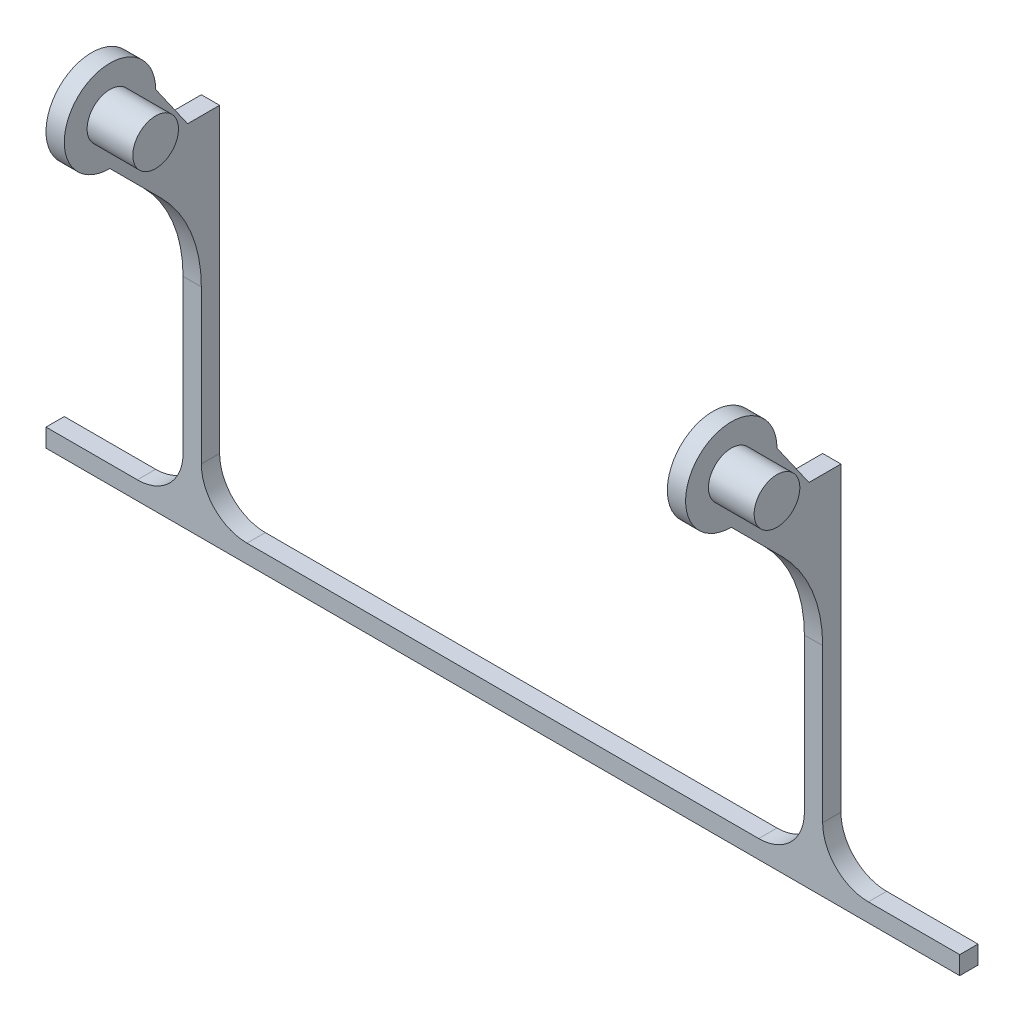
from build123d import *

# Parameters (mm, degrees)
BOSS_EXTRU_1_DEPTH = 4
BOSS_EXTRU_2_DEPTH = 4
BOSS_EXTRU_3_START = -4
BOSS_EXTRU_3_DEPTH = 4
CONG_1_R           = 30
CONG_2_R           = 30
CONG_3_R           = 10
BOSS_EXTRU_4_DEPTH = 4
BOSS_EXTRU_5_DEPTH = 4
ESQUISSE7_R        = 5
BOSS_EXTRU_6_DEPTH = 10
ESQUISSE9_R        = 5
BOSS_EXTRU_7_DEPTH = 14


with BuildPart() as part:
    # Esquisse1 → Boss.-Extru.1 (new body)
    with BuildSketch(Plane.XY):
        Polygon((-70, -110), (-66, -110), (-66, -176), (66, -176), (66, -110), (70, -110), (70, -176), (100, -176), (100, -180), (-100, -180), (-100, -176), (-70, -176), align=None)
    extrude(amount=-BOSS_EXTRU_1_DEPTH)

    # Esquisse2 → Boss.-Extru.2 (add)
    with BuildSketch(Plane(origin=(70, 0, 0), x_dir=(0, 0, -1), z_dir=(1, 0, 0))):
        with BuildLine():
            Line((0, -120), (-20, -100))
            ThreePointArc((-20, -100), (-27.071067812, -82.928932188), (-10, -90))
            Line((-10, -90), (4, -110))
            Line((4, -110), (0, -110))
            Line((0, -110), (0, -120))
        make_face()
    extrude(amount=-BOSS_EXTRU_2_DEPTH)

    # Esquisse3 → Boss.-Extru.3 (add)
    with BuildSketch(Plane.ZY.offset(70).offset(BOSS_EXTRU_3_START)):
        with BuildLine():
            Line((-4, -110), (10, -90))
            ThreePointArc((10, -90), (27.071067812, -82.928932188), (20, -100))
            Line((20, -100), (0, -120))
            Line((0, -120), (0, -110))
            Line((0, -110), (-4, -110))
        make_face()
    extrude(amount=BOSS_EXTRU_3_DEPTH)

    # Congé1
    cong_1_edges = [part.edges().sort_by_distance(p)[0] for p in [
        (68, -120, 0),
        (-68, -120, 0),
    ]]
    fillet(cong_1_edges, radius=CONG_1_R)

    # Congé2
    cong_2_edges = [part.edges().sort_by_distance(p)[0] for p in [
        (-68, -110, -4),
        (68, -110, -4),
    ]]
    fillet(cong_2_edges, radius=CONG_2_R)

    # Congé3
    cong_3_edges = [part.edges().sort_by_distance(p)[0] for p in [
        (66, -176, -2),
        (-66, -176, -2),
        (-70, -176, -2),
        (70, -176, -2),
    ]]
    fillet(cong_3_edges, radius=CONG_3_R)

    # Esquisse4 → Boss.-Extru.4 (add)
    with BuildSketch(Plane.ZY.offset(70)):
        Polygon((-4, -119.456666925), (-4, -100), (3, -100), align=None)
    extrude(amount=-BOSS_EXTRU_4_DEPTH)

    # Esquisse6 → Boss.-Extru.5 (add)
    with BuildSketch(Plane(origin=(70, 0, 0), x_dir=(0, 0, -1), z_dir=(1, 0, 0))):
        Polygon((4, -119.456666925), (4, -100), (-3, -100), align=None)
    extrude(amount=-BOSS_EXTRU_5_DEPTH)

    # Esquisse7 → Boss.-Extru.6 (add)
    with BuildSketch(Plane(origin=(70, 0, 0), x_dir=(0, 0, -1), z_dir=(1, 0, 0))):
        with Locations((-20, -90)):
            Circle(ESQUISSE7_R)
    extrude(amount=BOSS_EXTRU_6_DEPTH)

    # Esquisse9 → Boss.-Extru.7 (add)
    with BuildSketch(Plane.ZY.offset(70)):
        with Locations((20, -90)):
            Circle(ESQUISSE9_R)
    extrude(amount=-BOSS_EXTRU_7_DEPTH)


solid = part.part
